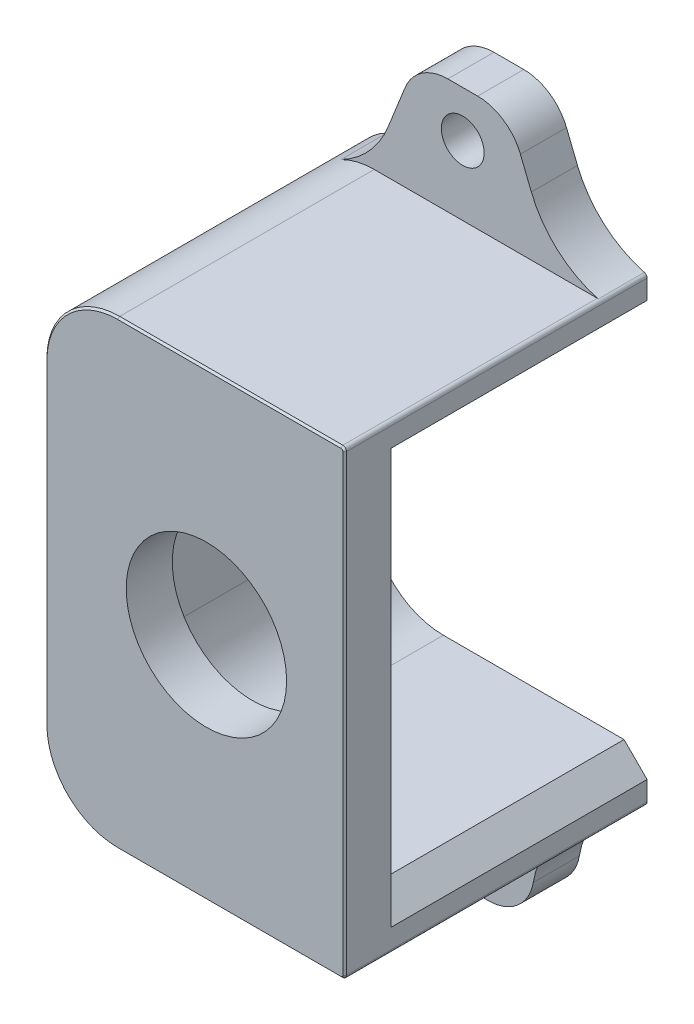
from build123d import *

# Parameters (mm, degrees)
BOSS_EXTRUDE1_DEPTH   = 9.525
SKETCH2_R             = 5.5245
CUT_EXTRUDE1_DEPTH    = 35.200748661
SKETCH11_W            = 17.653
SKETCH11_H            = 9.525
CUT_EXTRUDE4_DEPTH    = 38.971938112
F_4_CLEARANCE_HOLE1_D = 2.9464
CUT_EXTRUDE5_DEPTH    = 33.365321472
BOSS_EXTRUDE2_DEPTH   = 1.5875
SKETCH16_W            = 9.525
SKETCH16_H            = 50.8
BOSS_EXTRUDE3_DEPTH   = 3.175
FILLET1_R             = 5.0165
CUT_EXTRUDE6_DEPTH    = 38.184604546
FILLET3_R             = 0.254
CHAMFER1_SIZE         = 0.127
CHAMFER2_SIZE         = 1.5875
SKETCH18_OUTSIDE_W    = 44.691
SKETCH18_OUTSIDE_H    = 65.328
CUT_EXTRUDE7_DEPTH    = 38.184604546
FILLET5_START         = -20.828
FILLET5_DEPTH         = 3.175
FILLET6_R             = 3.175


with BuildPart() as part:
    # Sketch1 → Boss-Extrude1 (new, symmetric)
    with BuildSketch(Plane(origin=(0, 0, 0), x_dir=(0, 0, -1), z_dir=(1, 0, 0))):
        Polygon((0, 25.4), (0, -25.4), (20.828, -25.4), (20.828, -12.7), (3.175, -12.7), (3.175, 12.7), (20.828, 12.7), (20.828, 25.4), align=None)
    extrude(amount=BOSS_EXTRUDE1_DEPTH, both=True)

    # Sketch2 → Cut-Extrude1 (cut, through all)
    with BuildSketch(Plane.XY):
        Circle(SKETCH2_R)
    extrude(amount=-CUT_EXTRUDE1_DEPTH, mode=Mode.SUBTRACT)

    # Sketch11 → Cut-Extrude4 (cut, through all)
    with BuildSketch(Plane(origin=(9.525, 0, 0), x_dir=(0, 0, -1), z_dir=(1, 0, 0))):
        with Locations((8.8265, 20.6375)):
            Rectangle(SKETCH11_W, SKETCH11_H)
    cut_extrude4 = extrude(amount=-CUT_EXTRUDE4_DEPTH, mode=Mode.SUBTRACT)

    # #4 Clearance Hole1 (through all)
    with Locations(Plane.XY.offset(-17.653)):
        with Locations((0, 20.6375)):
            Hole(F_4_CLEARANCE_HOLE1_D / 2)

    # Mirror1: Cut-Extrude4 across plane
    add(cut_extrude4.mirror(Plane.ZX), mode=Mode.SUBTRACT)

    # Sketch14 → Cut-Extrude5 (cut, through all)
    with BuildSketch(Plane.XY.offset(-17.653)):
        with BuildLine():
            ThreePointArc((-1.864650295, -22.070013186), (0, -22.1107), (1.864650295, -22.070013186))
            ThreePointArc((1.864650295, -22.070013186), (3.272188054, -20.533955264), (1.736130132, -19.126417506))
            ThreePointArc((1.736130132, -19.126417506), (0, -19.1643), (-1.736130132, -19.126417506))
            ThreePointArc((-1.736130132, -19.126417506), (-3.272188054, -20.533955264), (-1.864650295, -22.070013186))
        make_face()
    extrude(amount=-CUT_EXTRUDE5_DEPTH, mode=Mode.SUBTRACT)

    # Sketch15 → Boss-Extrude2 (add)
    with BuildSketch(Plane.ZY.offset(9.525)):
        Polygon((-20.828, 12.7), (-20.828, 25.4), (-17.653, 25.4), (-17.653, 15.875), (0, 15.875), (0, -15.875), (-17.653, -15.875), (-17.653, -25.4), (-20.828, -25.4), (-20.828, -12.7), align=None)
    extrude(amount=BOSS_EXTRUDE2_DEPTH)

    # Sketch16 → Boss-Extrude3 (add)
    with BuildSketch(Plane.XY.offset(-17.653)):
        with Locations((-15.875, 0)):
            Rectangle(SKETCH16_W, SKETCH16_H)
    extrude(amount=-BOSS_EXTRUDE3_DEPTH)

    # Fillet1
    fillet1_edges = [part.edges().sort_by_distance(p)[0] for p in [
        (-9.525, 12.7, -12.0015),
        (-11.1125, -15.875, -8.8265),
        (-11.1125, 15.875, -8.8265),
        (-9.525, -12.7, -12.0015),
    ]]
    fillet(fillet1_edges, radius=FILLET1_R)

    # Sketch17 → Cut-Extrude6 (cut, through all)
    with BuildSketch(Plane.XY.offset(-17.653)):
        with BuildLine():
            ThreePointArc((-16.603528504, -0.49285067), (-15.666032673, -1.196975), (-14.698715658, -1.859536166))
            ThreePointArc((-14.698715658, -1.859536166), (-12.659629074, -1.432028992), (-13.087136248, 0.607057592))
            ThreePointArc((-13.087136248, 0.607057592), (-13.94839582, 1.196975), (-14.783103829, 1.823898553))
            ThreePointArc((-14.783103829, 1.823898553), (-16.851690778, 1.575736279), (-16.603528504, -0.49285067))
        make_face()
    extrude(amount=-CUT_EXTRUDE6_DEPTH, mode=Mode.SUBTRACT)

    # Fillet3
    fillet3_edges = [part.edges().sort_by_distance(p)[0] for p in [
        (9.525, 15.875, -8.8265),
        (9.525, -15.875, -8.8265),
    ]]
    fillet(fillet3_edges, radius=FILLET3_R)

    # Chamfer1
    chamfer1_edges = [part.edges().sort_by_distance(p)[0] for p in [
        (-11.1125, 0, 0),
        (1.5875, 15.875, 0),
        (1.5875, -15.875, 0),
        (-9.643201168, -14.405701168, 0),
        (-9.643201168, 14.405701168, 0),
        (9.525, 0, 0),
        (9.450605122, -15.800605122, 0),
        (9.450605122, 15.800605122, 0),
    ]]
    chamfer(chamfer1_edges, length=CHAMFER1_SIZE)

    # Chamfer2
    chamfer2_edges = [part.edges().sort_by_distance(p)[0] for p in [
        (9.525, -12.7, -12.0015),
        (9.525, 12.7, -12.0015),
    ]]
    chamfer(chamfer2_edges, length=CHAMFER2_SIZE)

    # Sketch18 outside → Cut-Extrude7 (cut, through all)
    with BuildSketch(Plane.XY.offset(-17.653)):
        with Locations((-5.5565, 0)):
            Rectangle(SKETCH18_OUTSIDE_W, SKETCH18_OUTSIDE_H)
        with BuildLine():
            Line((9.525, 15.621), (9.525, -15.621))
            ThreePointArc((9.525, -15.621), (9.450605122, -15.800605122), (9.271, -15.875))
            Line((9.271, -15.875), (4.7625, -15.875))
            Line((4.7625, -15.875), (4.7625, -23.8125))
            Line((4.7625, -23.8125), (-4.7625, -23.8125))
            Line((-4.7625, -23.8125), (-4.7625, -15.875))
            Line((-4.7625, -15.875), (-6.096, -15.875))
            ThreePointArc((-6.096, -15.875), (-9.643201168, -14.405701168), (-11.1125, -10.8585))
            Line((-11.1125, -10.8585), (-11.1125, -5.684476059))
            Line((-11.1125, -5.684476059), (-18.868316167, -1.715726059))
            Line((-18.868316167, -1.715726059), (-18.868316167, 3.046773941))
            Line((-18.868316167, 3.046773941), (-11.1125, 7.015523941))
            Line((-11.1125, 7.015523941), (-11.1125, 10.8585))
            ThreePointArc((-11.1125, 10.8585), (-9.730137534, 14.316579906), (-6.344906405, 15.868821133))
            Line((-6.344906405, 15.868821133), (-3.175, 23.8125))
            Line((-3.175, 23.8125), (3.175, 23.8125))
            Line((3.175, 23.8125), (6.360346812, 15.875))
            Line((6.360346812, 15.875), (9.271, 15.875))
            ThreePointArc((9.271, 15.875), (9.450605122, 15.800605122), (9.525, 15.621))
        make_face(mode=Mode.SUBTRACT)
    extrude(amount=-CUT_EXTRUDE7_DEPTH, mode=Mode.SUBTRACT)

    # Fillet5: read off the stored shape, not the designer's step
    # Fillet5 outline → Fillet5 (add)
    with BuildSketch(Plane.XY.offset(FILLET5_START)):
        with BuildLine():
            Line((-6.344906405, 15.868821133), (-5.141439076, 18.884669795))
            ThreePointArc((-5.141439076, 18.884669795), (-6.439586705, 16.809867774), (-8.383629538, 15.323029465))
            ThreePointArc((-8.383629538, 15.323029465), (-7.393295565, 15.704353533), (-6.344906405, 15.868821133))
        make_face()
        with BuildLine():
            Line((4.728452297, 19.941484272), (6.360346812, 15.875))
            Line((6.360346812, 15.875), (9.271, 15.875))
            ThreePointArc((9.271, 15.875), (9.303812086, 15.872871727), (9.336074306, 15.866522574))
            ThreePointArc((9.336074306, 15.866522574), (6.549781647, 17.358453978), (4.728452297, 19.941484272))
        make_face()
        with BuildLine():
            Line((9.271, -15.875), (4.7625, -15.875))
            Line((4.7625, -15.875), (4.7625, -22.333703908))
            ThreePointArc((4.7625, -22.333703908), (6.027219419, -18.365407505), (9.354910714, -15.860739425))
            ThreePointArc((9.354910714, -15.860739425), (9.313556938, -15.871409478), (9.271, -15.875))
        make_face()
        with BuildLine():
            ThreePointArc((-6.096, -15.875), (-7.297950449, -15.728878565), (-8.429879679, -15.299026759))
            ThreePointArc((-8.429879679, -15.299026759), (-5.750515411, -17.823432924), (-4.7625, -21.369620302))
            Line((-4.7625, -21.369620302), (-4.7625, -15.875))
            Line((-4.7625, -15.875), (-6.096, -15.875))
        make_face()
        with BuildLine():
            Line((-11.1125, -9.878885048), (-11.1125, -5.684476059))
            Line((-11.1125, -5.684476059), (-14.846436435, -3.773773186))
            ThreePointArc((-14.846436435, -3.773773186), (-12.119987547, -6.300663697), (-11.1125, -9.878885048))
        make_face()
        with BuildLine():
            ThreePointArc((-11.1125, 10.8585), (-11.11194212, 10.933312395), (-11.110268606, 11.008108151))
            ThreePointArc((-11.110268606, 11.008108151), (-12.168719233, 7.547562085), (-14.841154527, 5.107523888))
            Line((-14.841154527, 5.107523888), (-11.1125, 7.015523941))
            Line((-11.1125, 7.015523941), (-11.1125, 10.8585))
        make_face()
    extrude(amount=FILLET5_DEPTH)

    # Fillet6
    fillet6_edges = [part.edges().sort_by_distance(p)[0] for p in [
        (-3.175, 23.8125, -19.2405),
        (3.175, 23.8125, -19.2405),
        (4.7625, -23.8125, -19.2405),
        (-4.7625, -23.8125, -19.2405),
        (-18.868316167, 3.046773941, -19.2405),
        (-18.868316167, -1.715726059, -19.2405),
    ]]
    fillet(fillet6_edges, radius=FILLET6_R)


solid = part.part
